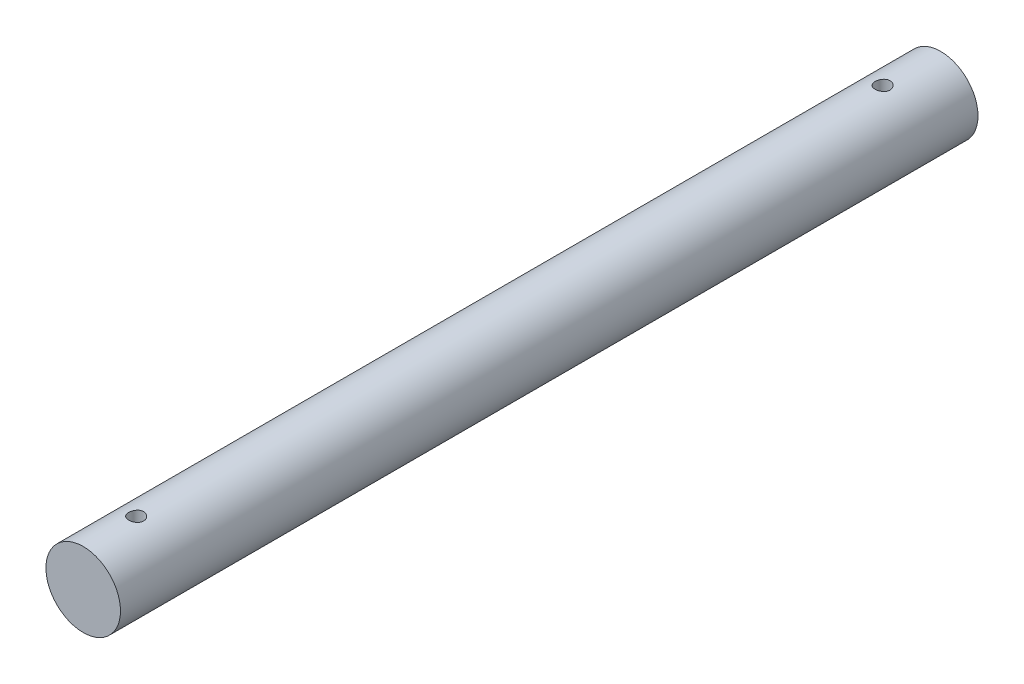
from build123d import *

# Parameters (mm, degrees)
SKETCH_1_R          = 5
EXTRUDE_1_DEPTH     = 115
SKETCH_2_R          = 1
CUT_EXTRUDE_1_DEPTH = 10
SKETCH_4_R          = 1
CUT_EXTRUDE_2_DEPTH = 10


with BuildPart() as part:
    # Эскиз1 → Вытянуть1 (new body)
    with BuildSketch(Plane.XY):
        Circle(SKETCH_1_R)
    extrude(amount=EXTRUDE_1_DEPTH)

    # Эскиз2 → Вырез-Вытянуть1 (cut, symmetric)
    with BuildSketch(Plane(origin=(0, 0, 0), x_dir=(1, 0, 0), z_dir=(0, 1, 0))):
        with Locations((0, -7.801268192)):
            Circle(SKETCH_2_R)
    extrude(amount=CUT_EXTRUDE_1_DEPTH, both=True, mode=Mode.SUBTRACT)

    # Эскиз4 → Вырез-Вытянуть2 (cut, symmetric)
    with BuildSketch(Plane(origin=(0, 0, 0), x_dir=(1, 0, 0), z_dir=(0, 1, 0))):
        with Locations((0, -107.898465976)):
            Circle(SKETCH_4_R)
    extrude(amount=CUT_EXTRUDE_2_DEPTH, both=True, mode=Mode.SUBTRACT)


solid = part.part
